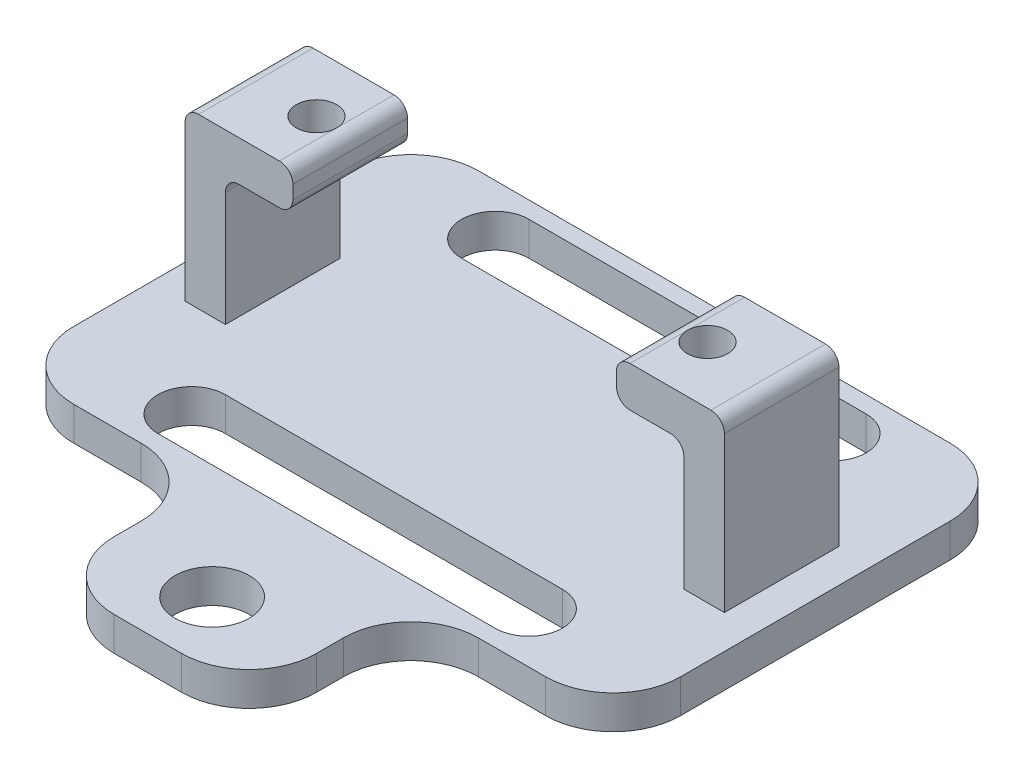
from build123d import *

# Parameters (mm, degrees)
SKETCH1_R            = 2.7499999999999987
BOSS_EXTRUDE1_DEPTH  = 2.5
BOSS_EXTRUDE3_DEPTH  = 4.25
SKETCH5_R            = 1.4999999999999967
CUT_EXTRUDE1_DEPTH   = 5
FILLET1_R            = 1
FILLET2_R            = 1
FILLET3_R            = 1
FILLET4_R            = 1
FILLET1_OF_MIRROR1_R = 1
FILLET2_OF_MIRROR1_R = 1
FILLET3_OF_MIRROR1_R = 1
FILLET4_OF_MIRROR1_R = 1
FILLET5_R            = 5
FILLET6_R            = 5


with BuildPart() as part:
    # Sketch1 → Boss-Extrude1 (new body)
    with BuildSketch(Plane(origin=(0, 0, 0), x_dir=(1, 0, 0), z_dir=(0, 1, 0))):
        Polygon((0, 0), (-30, 0), (-45, -5.51e-15), (-45, -30), (-29.999999999999996, -30), (-30, -42), (-15, -42), (-15, -30.000000000000004), (0, -30), align=None)
        with Locations(Location((-22.5, -37.239999999999995, 0), (0, 0, 270))):
            Circle(SKETCH1_R, mode=Mode.SUBTRACT)
        with BuildLine():
            Line((-34.99999999999999, -1.239999999999998), (-10.000000000000002, -1.240000000000011))
            ThreePointArc((-10.000000000000002, -1.240000000000011), (-7.500000000000012, -3.7400000000000007), (-10.000000000000002, -6.2399999999999896))
            Line((-10.000000000000002, -6.2399999999999896), (-34.99999999999999, -6.240000000000009))
            ThreePointArc((-34.99999999999999, -6.240000000000009), (-37.5, -3.7400000000000015), (-34.99999999999999, -1.239999999999998))
        make_face(mode=Mode.SUBTRACT)
        with BuildLine():
            Line((-34.99999999999999, -23.75999999999999), (-10.000000000000002, -23.76000000000001))
            ThreePointArc((-10.000000000000002, -23.76000000000001), (-7.500000000000012, -26.259999999999998), (-10.000000000000002, -28.759999999999987))
            Line((-10.000000000000002, -28.759999999999987), (-34.99999999999999, -28.76))
            ThreePointArc((-34.99999999999999, -28.76), (-37.5, -26.259999999999998), (-34.99999999999999, -23.75999999999999))
        make_face(mode=Mode.SUBTRACT)
    extrude(amount=BOSS_EXTRUDE1_DEPTH)

    # Sketch3 → Boss-Extrude3 (add, symmetric)
    with BuildSketch(Plane.XY.offset(14.999999999999995)):
        Polygon((-39.5, 2.5), (-42.5, 2.5000000000000004), (-42.5, 12), (-42.5, 15.000000000000007), (-34.5, 15.000000000000004), (-34.5, 12), (-39.5, 12), align=None)
    boss_extrude3 = extrude(amount=BOSS_EXTRUDE3_DEPTH, both=True)

    # Sketch5 → Cut-Extrude1 (cut)
    with BuildSketch(Plane(origin=(6.51e-15, 14.999999999999988, 0), x_dir=(1, 0, 0), z_dir=(0, 1, 0))):
        with Locations(Location((-36.99999999999999, -15, 0), (0, 0, 270))):
            Circle(SKETCH5_R)
    cut_extrude1 = extrude(amount=-CUT_EXTRUDE1_DEPTH, mode=Mode.SUBTRACT)

    # Fillet1
    fillet1_edges = [part.edges().sort_by_distance(p)[0] for p in [
        (-39.49999999999999, 12, 14.999999999999993),
    ]]
    fillet(fillet1_edges, radius=FILLET1_R)

    # Fillet2
    fillet2_edges = [part.edges().sort_by_distance(p)[0] for p in [
        (-34.49999999999999, 12, 14.999999999999993),
    ]]
    fillet(fillet2_edges, radius=FILLET2_R - 0.0001)  # a hair under: the kernel refuses the full size

    # Fillet3
    fillet3_edges = [part.edges().sort_by_distance(p)[0] for p in [
        (-34.49999999999999, 15.000000000000004, 14.999999999999993),
    ]]
    fillet(fillet3_edges, radius=FILLET3_R - 0.0001)  # a hair under: the kernel refuses the full size

    # Fillet4
    fillet4_edges = [part.edges().sort_by_distance(p)[0] for p in [
        (-42.49999999999999, 15.000000000000007, 14.999999999999993),
    ]]
    fillet(fillet4_edges, radius=FILLET4_R)

    # Mirror1: Boss-Extrude3, Cut-Extrude1 across plane
    add(boss_extrude3.mirror(Plane(origin=(-22.5, 0, 0), x_dir=(6e-17, 0, 1), z_dir=(1, 0, -6e-17))))
    add(cut_extrude1.mirror(Plane(origin=(-22.5, 0, 0), x_dir=(6e-17, 0, 1), z_dir=(1, 0, -6e-17))), mode=Mode.SUBTRACT)

    # Fillet1 of Mirror1
    fillet1_of_mirror1_edges = [part.edges().sort_by_distance(p)[0] for p in [
        (-5.500000000000007, 12, 14.999999999999991),
    ]]
    fillet(fillet1_of_mirror1_edges, radius=FILLET1_OF_MIRROR1_R)

    # Fillet2 of Mirror1
    fillet2_of_mirror1_edges = [part.edges().sort_by_distance(p)[0] for p in [
        (-10.500000000000007, 12, 14.999999999999993),
    ]]
    fillet(fillet2_of_mirror1_edges, radius=FILLET2_OF_MIRROR1_R - 0.0001)  # a hair under: the kernel refuses the full size

    # Fillet3 of Mirror1
    fillet3_of_mirror1_edges = [part.edges().sort_by_distance(p)[0] for p in [
        (-10.500000000000007, 15.000000000000004, 14.999999999999993),
    ]]
    fillet(fillet3_of_mirror1_edges, radius=FILLET3_OF_MIRROR1_R - 0.0001)  # a hair under: the kernel refuses the full size

    # Fillet4 of Mirror1
    fillet4_of_mirror1_edges = [part.edges().sort_by_distance(p)[0] for p in [
        (-2.500000000000007, 15.000000000000007, 14.999999999999991),
    ]]
    fillet(fillet4_of_mirror1_edges, radius=FILLET4_OF_MIRROR1_R)

    # Fillet5
    fillet5_edges = [part.edges().sort_by_distance(p)[0] for p in [
        (-15, 1.25, 30.000000000000004),
        (-29.999999999999996, 1.25, 30),
    ]]
    fillet(fillet5_edges, radius=FILLET5_R)

    # Fillet6
    fillet6_edges = [part.edges().sort_by_distance(p)[0] for p in [
        (0, 1.25, 30),
        (-15, 1.25, 42),
        (-30, 1.25, 42),
        (-45, 1.25, 30),
        (-45, 1.25, 5.51e-15),
        (0, 1.25, 0),
    ]]
    fillet(fillet6_edges, radius=FILLET6_R)


solid = part.part
